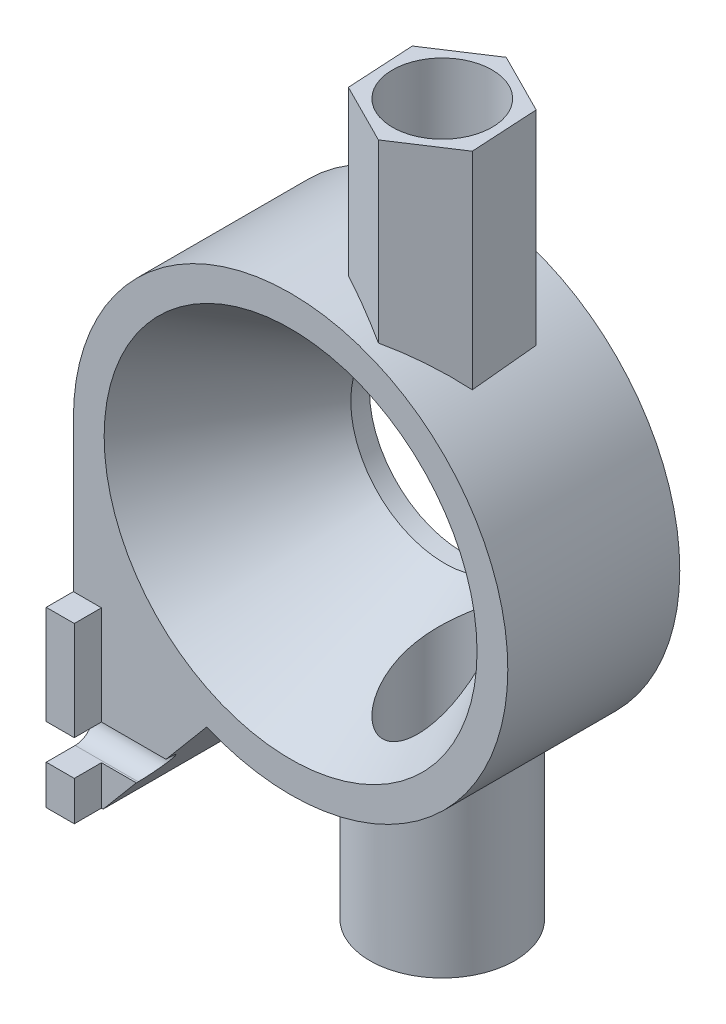
from build123d import *

# Parameters (mm, degrees)
SKETCH3_R           = 24
BOSS_EXTRUDE1_DEPTH = 19
BOSS_EXTRUDE2_DEPTH = 19
SKETCH7_R           = 8
BOSS_EXTRUDE3_DEPTH = 22.5
BOSS_EXTRUDE4_DEPTH = 26
SKETCH9_W           = 3
SKETCH9_H           = 19.17
BOSS_EXTRUDE5_DEPTH = 3.1
CUT_EXTRUDE1_DEPTH  = 15
SKETCH15_R          = 21.7
CUT_EXTRUDE3_DEPTH  = 2
SKETCH17_R          = 12.95
SKETCH17_R_2        = 10.35
BOSS_EXTRUDE9_DEPTH = 2.06
SKETCH24_R          = 5.5
CUT_EXTRUDE5_DEPTH  = 263.006202312


with BuildPart() as part:
    # Sketch3 → Boss-Extrude1 (new body)
    with BuildSketch(Plane.XY):
        with Locations((225, 142.5)):
            Circle(SKETCH3_R)
    extrude(amount=BOSS_EXTRUDE1_DEPTH)

    # Sketch5 → Boss-Extrude2 (add)
    with BuildSketch(Plane.XY):
        with BuildLine():
            Line((201, 142.5), (201, 106.774519899))
            Line((201, 106.774519899), (204.286593584, 106.774519899))
            Line((204.286593584, 106.774519899), (215.733540757, 120.361058447))
            ThreePointArc((215.733540757, 120.361058447), (205.020072299, 129.203290291), (201, 142.5))
        make_face()
    extrude(amount=BOSS_EXTRUDE2_DEPTH)

    # Sketch7 → Boss-Extrude3 (add)
    with BuildSketch(Plane(origin=(0, 128.5, 0), x_dir=(-1, 0, 0), z_dir=(0, -1, 0))):
        with Locations((-232.76, -10)):
            Circle(SKETCH7_R)
    extrude(amount=BOSS_EXTRUDE3_DEPTH)

    # Sketch8 → Boss-Extrude4 (add)
    with BuildSketch(Plane(origin=(0, 158.5, 0), x_dir=(-1, 0, 0), z_dir=(0, -1, 0))):
        Polygon((-239.027907652, -5.894705912), (-239.449242796, -13.375520211), (-233.181335144, -17.480814299), (-226.492092348, -14.105294088), (-226.070757204, -6.624479789), (-232.338664856, -2.519185701), align=None)
    extrude(amount=-BOSS_EXTRUDE4_DEPTH)

    # Sketch9 → Boss-Extrude5 (add)
    with BuildSketch(Plane.ZY.offset(-201)):
        with Locations((20.5, 116.359519899)):
            Rectangle(SKETCH9_W, SKETCH9_H)
    extrude(amount=-BOSS_EXTRUDE5_DEPTH)

    # Sketch10 → Cut-Extrude1 (cut)
    with BuildSketch(Plane.ZY.offset(-201)):
        with BuildLine():
            Line((0, 115.014519899), (0, 111.124519899))
            Line((0, 111.124519899), (3.205, 111.124519899))
            ThreePointArc((3.205, 111.124519899), (5.15, 113.069519899), (3.205, 115.014519899))
            Line((3.205, 115.014519899), (0, 115.014519899))
        make_face()
        with BuildLine():
            Line((22, 111.124519899), (22, 115.014519899))
            Line((22, 115.014519899), (18.795, 115.014519899))
            ThreePointArc((18.795, 115.014519899), (16.85, 113.069519899), (18.795, 111.124519899))
            Line((18.795, 111.124519899), (22, 111.124519899))
        make_face()
    extrude(amount=-CUT_EXTRUDE1_DEPTH, mode=Mode.SUBTRACT)

    # Sketch15 → Cut-Extrude3 (cut)
    with BuildSketch(Plane(origin=(0, 0, 0), x_dir=(-1, 0, 0), z_dir=(0, 0, -1))):
        with Locations((-225, 142.5)):
            Circle(SKETCH15_R)
    extrude(amount=-CUT_EXTRUDE3_DEPTH, mode=Mode.SUBTRACT)

    # Sketch17 → Boss-Extrude9 (add)
    with BuildSketch(Plane(origin=(0, 0, 2), x_dir=(-1, 0, 0), z_dir=(0, 0, -1))):
        with Locations((-225, 142.5)):
            Circle(SKETCH17_R)
        with Locations((-225, 142.5)):
            Circle(SKETCH17_R_2, mode=Mode.SUBTRACT)
    extrude(amount=BOSS_EXTRUDE9_DEPTH)

    # Sketch21 → Cut-Revolve2 (revolve, cut)
    with BuildSketch(Plane(origin=(225, 0, 0), x_dir=(0, 0, -1), z_dir=(1, 0, 0))):
        Polygon((-19, 163.1), (-19, 142.5), (-2, 142.5), (-2, 152.85), align=None)
    revolve(axis=Axis((225, 142.5, 19), (0, 0, -1)), mode=Mode.SUBTRACT)

    # Sketch24 → Cut-Extrude5 (cut, through all)
    with BuildSketch(Plane.XZ.offset(-106)):
        with Locations((232.76, 10)):
            Circle(SKETCH24_R)
    extrude(amount=-CUT_EXTRUDE5_DEPTH, mode=Mode.SUBTRACT)


solid = part.part
